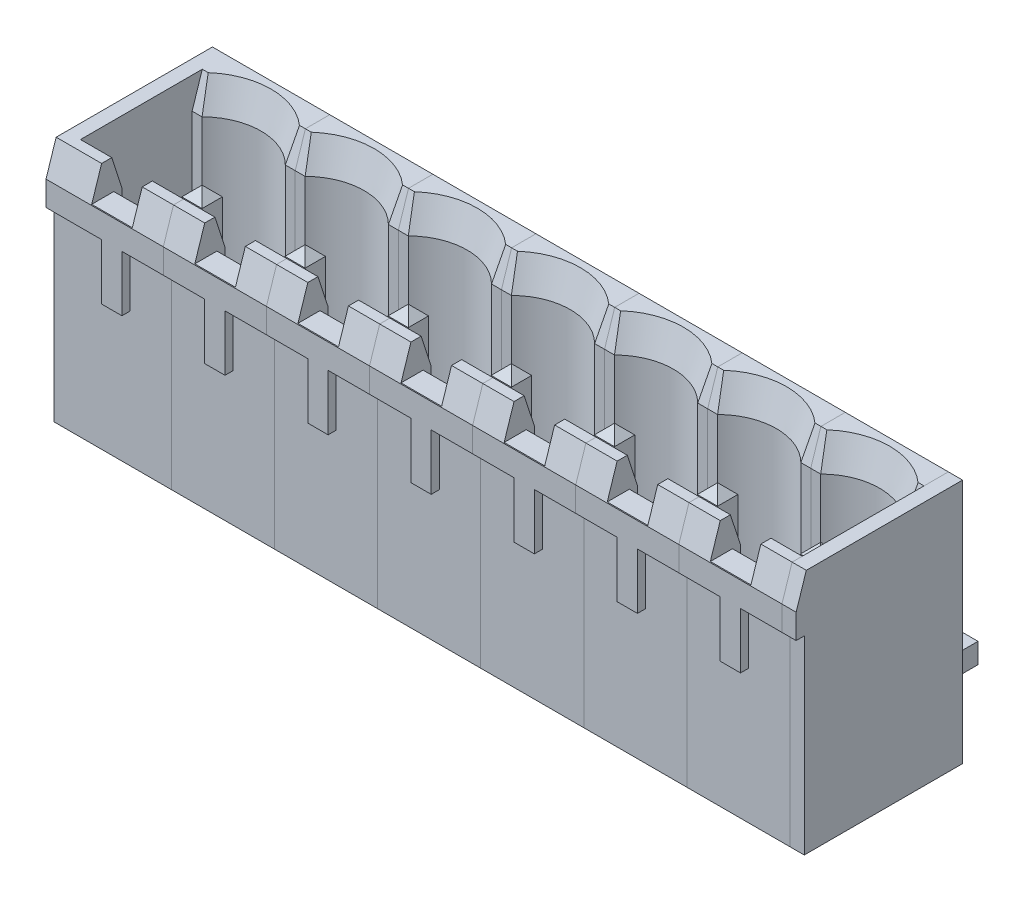
from build123d import *
from OCP.BRepFilletAPI import BRepFilletAPI_MakeChamfer

# Parameters (mm, degrees)
SKETCH_1_W             = 5.08
SKETCH_1_H             = 12.1
EXTRUDE_1_DEPTH        = 8.2
CUT_EXTRUDE_1_DEPTH    = 8.7
SKETCH_3_R             = 1.2
EXTRUDE_2_DEPTH        = 2
FILLET_1_R             = 0.25
CHAMFER_1_SIZE         = 0.5
CHAMFER_1_SIZE2        = 1.538841769
SKETCH_4_W             = 2
SKETCH_4_H             = 1.010953213
CUT_EXTRUDE_2_DEPTH    = 4.75
SKETCH_5_W             = 2
SKETCH_5_H             = 1.705458635
CUT_EXTRUDE_3_DEPTH    = 1.5
CHAMFER_2_SIZE         = 0.5
CHAMFER_2_SIZE2        = 1.538841769
SKETCH_6_W             = 5.08
SKETCH_6_H             = 6.6
CUT_EXTRUDE_4_DEPTH    = 0.4
SKETCH_7_W             = 2.04
SKETCH_7_H             = 2.75
CUT_EXTRUDE_5_DEPTH    = 0.4
EXTRUDE_1_2_DEPTH      = 0.5
EXTRUDE_1_2_DEPTH_BACK = 0.5
CHAMFER_3_SIZE         = 0.5
SKETCH_9_W             = 1
SKETCH_9_H             = 2.1
SKETCH_9_W_2           = 1.04
CUT_EXTRUDE_6_DEPTH    = 6
PATTERN_LINEAR_1_COUNT = 7
PATTERN_LINEAR_1_PITCH = 5.08
EXTRUDE_3_DEPTH        = 0.7
EXTRUDE_4_DEPTH        = 0.7
MOVE_BODY_1_ANGLE      = 180


with BuildPart() as part:
    # Эскиз1 → Extrude 1 (new body)
    with BuildSketch(Plane(origin=(0, 0, 0), x_dir=(1, 0, 0), z_dir=(0, 1, 0))):
        Rectangle(SKETCH_1_W, SKETCH_1_H)
    extrude(amount=EXTRUDE_1_DEPTH)

    # Эскиз2 → Вырез-Вытянуть1 (cut)
    with BuildSketch(Plane.XY.offset(6.05)):
        with BuildLine():
            Line((-2.54, 6.7), (2.54, 6.7))
            Line((2.54, 6.7), (2.54, 1.7))
            Line((2.54, 1.7), (2.05121915, 1.7))
            ThreePointArc((2.05121915, 1.7), (0, 0.85), (-2.05121915, 1.7))
            Line((-2.05121915, 1.7), (-2.54, 1.7))
            Line((-2.54, 1.7), (-2.54, 6.7))
        make_face()
    extrude(amount=-CUT_EXTRUDE_1_DEPTH, mode=Mode.SUBTRACT)

    # Эскиз3 → Бобышка-Вытянуть2 (add)
    with BuildSketch(Plane.XY.offset(-2.65)):
        with Locations((0, 3.75)):
            Circle(SKETCH_3_R)
    extrude(amount=EXTRUDE_2_DEPTH)

    # Скругление1
    fillet_1_edges = [part.edges().sort_by_distance(p)[0] for p in [
        (-1.2, 3.75, -0.65),
    ]]
    fillet(fillet_1_edges, radius=FILLET_1_R)

    # Фаска1: one chamfer whose edges measure the first distance from different faces: ONE call of the kernel's chamfer builder (chamfer() names one face for all edges)
    chamfer_1_edges_1 = [part.edges().sort_by_distance(p)[0] for p in [
        (0, 6.7, 6.05),
    ]]
    chamfer_1_side_1 = [part.faces().sort_by_distance(p)[0] for p in [
        (0, 7.45, 6.05),
    ]]
    chamfer_1_edges_2 = [part.edges().sort_by_distance(p)[0] for p in [
        (2.295609575, 1.7, 6.05),
        (-2.295609575, 1.7, 6.05),
        (0, 0.85, 6.05),
    ]]
    chamfer_1_side_2 = [part.faces().sort_by_distance(p)[0] for p in [
        (0, 0.655214235, 6.05),
    ]]
    chamfer_1 = BRepFilletAPI_MakeChamfer(part.part.solid().wrapped)
    for e in chamfer_1_edges_1:
        chamfer_1.Add(CHAMFER_1_SIZE, CHAMFER_1_SIZE2, e.wrapped, chamfer_1_side_1[0].wrapped)  # the first distance lies on this face
    for e in chamfer_1_edges_2:
        chamfer_1.Add(CHAMFER_1_SIZE, CHAMFER_1_SIZE2, e.wrapped, chamfer_1_side_2[0].wrapped)  # the first distance lies on this face
    add(Compound.cast(chamfer_1.Shape()), mode=Mode.REPLACE)

    # Эскиз4 → Вырез-Вытянуть2 (cut)
    with BuildSketch(Plane.XY.offset(6.05)):
        with Locations((0, 6.594523394)):
            Rectangle(SKETCH_4_W, SKETCH_4_H)
    extrude(amount=-CUT_EXTRUDE_2_DEPTH, mode=Mode.SUBTRACT)

    # Эскиз5 → Вырез-Вытянуть3 (cut)
    with BuildSketch(Plane.XY.offset(6.05)):
        with Locations((0, 7.552729318)):
            Rectangle(SKETCH_5_W, SKETCH_5_H)
    extrude(amount=-CUT_EXTRUDE_3_DEPTH, mode=Mode.SUBTRACT)

    # Фаска2
    chamfer_2_edges = [part.edges().sort_by_distance(p)[0] for p in [
        (-1.77, 8.2, 6.05),
    ]]
    chamfer_2_side = [part.faces().sort_by_distance(p)[0] for p in [
        (-1.77, 7.7, 6.05),
    ]]
    chamfer(chamfer_2_edges, length=CHAMFER_2_SIZE, length2=CHAMFER_2_SIZE2, reference=chamfer_2_side[0])

    # Эскиз6 → Вырез-Вытянуть4 (cut)
    with BuildSketch(Plane(origin=(0, 8.2, 0), x_dir=(1, 0, 0), z_dir=(0, 1, 0))):
        with Locations((0, 2.75)):
            Rectangle(SKETCH_6_W, SKETCH_6_H)
    extrude(amount=-CUT_EXTRUDE_4_DEPTH, mode=Mode.SUBTRACT)

    # Эскиз7 → Вырез-Вытянуть5 (cut)
    with BuildSketch(Plane(origin=(0, 8.2, 0), x_dir=(1, 0, 0), z_dir=(0, 1, 0))):
        with Locations((1.52, -1.925)):
            Rectangle(SKETCH_7_W, SKETCH_7_H)
        with Locations((-1.52, -1.925)):
            Rectangle(SKETCH_7_W, SKETCH_7_H)
    extrude(amount=-CUT_EXTRUDE_5_DEPTH, mode=Mode.SUBTRACT)

    # Эскиз9 → Вырез-Вытянуть6 (cut)
    with BuildSketch(Plane.XZ):
        with Locations((0, -5)):
            Rectangle(SKETCH_9_W, SKETCH_9_H)
        with Locations((-2.02, -5)):
            Rectangle(SKETCH_9_W_2, SKETCH_9_H)
        with Locations((2.02, -5)):
            Rectangle(SKETCH_9_W_2, SKETCH_9_H)
    extrude(amount=-CUT_EXTRUDE_6_DEPTH, mode=Mode.SUBTRACT)


with BuildPart() as body_2:
    # Эскиз8 → Extrude 1 2 (new, two sides: drawn at the far end of the back side and taken through both)
    with BuildSketch(Plane(origin=(0, 0, 0), x_dir=(0, 0, -1), z_dir=(1, 0, 0)).offset(-EXTRUDE_1_2_DEPTH_BACK)):
        with BuildLine():
            Line((-3.65, 3.25), (3.95, 3.25))
            Line((3.95, 3.25), (3.95, -4))
            Line((3.95, -4), (4.95, -4))
            Line((4.95, -4), (4.95, 3.25))
            ThreePointArc((4.95, 3.25), (4.657106781, 3.957106781), (3.95, 4.25))
            Line((3.95, 4.25), (-3.65, 4.25))
            Line((-3.65, 4.25), (-3.65, 3.25))
        make_face()
    extrude(amount=EXTRUDE_1_2_DEPTH + EXTRUDE_1_2_DEPTH_BACK)

    # Фаска3
    chamfer_3_edges = [body_2.edges().sort_by_distance(p)[0] for p in [
        (0, 3.25, 3.65),
        (0, 4.25, 3.65),
        (0, -4, -4.95),
        (0, -4, -3.95),
        (0.5, -4, -4.45),
        (0.5, 3.75, 3.65),
        (-0.5, 3.75, 3.65),
        (-0.5, -4, -4.45),
    ]]
    chamfer(chamfer_3_edges, length=CHAMFER_3_SIZE - 0.0001)  # a hair under: the kernel refuses the full size


with BuildPart() as pattern_linear_1_1:
    # Линейный массив1: pattern copy
    add(part.part.moved(Location(Vector(-1, 0, 0) * (1 * PATTERN_LINEAR_1_PITCH))))


with BuildPart() as pattern_linear_1_2:
    # Линейный массив1: pattern copy
    add(part.part.moved(Location(Vector(-1, 0, 0) * (2 * PATTERN_LINEAR_1_PITCH))))


with BuildPart() as pattern_linear_1_3:
    # Линейный массив1: pattern copy
    add(part.part.moved(Location(Vector(-1, 0, 0) * (3 * PATTERN_LINEAR_1_PITCH))))


with BuildPart() as pattern_linear_1_4:
    # Линейный массив1: pattern copy
    add(part.part.moved(Location(Vector(-1, 0, 0) * (4 * PATTERN_LINEAR_1_PITCH))))


with BuildPart() as pattern_linear_1_5:
    # Линейный массив1: pattern copy
    add(part.part.moved(Location(Vector(-1, 0, 0) * (5 * PATTERN_LINEAR_1_PITCH))))


with BuildPart() as pattern_linear_1_6:
    # Линейный массив1: pattern copy
    add(part.part.moved(Location(Vector(-1, 0, 0) * (6 * PATTERN_LINEAR_1_PITCH))))


with BuildPart() as pattern_linear_1_7:
    # Линейный массив1: pattern copy
    add(body_2.part.moved(Location(Vector(-1, 0, 0) * (1 * PATTERN_LINEAR_1_PITCH))))


with BuildPart() as pattern_linear_1_8:
    # Линейный массив1: pattern copy
    add(body_2.part.moved(Location(Vector(-1, 0, 0) * (2 * PATTERN_LINEAR_1_PITCH))))


with BuildPart() as pattern_linear_1_9:
    # Линейный массив1: pattern copy
    add(body_2.part.moved(Location(Vector(-1, 0, 0) * (3 * PATTERN_LINEAR_1_PITCH))))


with BuildPart() as pattern_linear_1_10:
    # Линейный массив1: pattern copy
    add(body_2.part.moved(Location(Vector(-1, 0, 0) * (4 * PATTERN_LINEAR_1_PITCH))))


with BuildPart() as pattern_linear_1_11:
    # Линейный массив1: pattern copy
    add(body_2.part.moved(Location(Vector(-1, 0, 0) * (5 * PATTERN_LINEAR_1_PITCH))))


with BuildPart() as pattern_linear_1_12:
    # Линейный массив1: pattern copy
    add(body_2.part.moved(Location(Vector(-1, 0, 0) * (6 * PATTERN_LINEAR_1_PITCH))))


with BuildPart() as part_1:
    add(part.part)

    # Эскиз10 → Бобышка-Вытянуть3 (add)
    with BuildSketch(Plane(origin=(2.54, 0, 0), x_dir=(0, 0, -1), z_dir=(1, 0, 0))):
        Polygon((6.05, 7.8), (-3.3, 7.8), (-3.3, 8.2), (-4.511158231, 8.2), (-6.05, 7.7), (-6.05, 0), (6.05, 0), align=None)
    extrude(amount=EXTRUDE_3_DEPTH)


with BuildPart() as body_15:
    # Эскиз11 → Бобышка-Вытянуть4 (new body)
    with BuildSketch(Plane.ZY.offset(33.02)):
        Polygon((-6.05, 7.8), (-6.05, 0), (6.05, 0), (6.05, 7.7), (4.511158231, 8.2), (3.3, 8.2), (3.3, 7.8), align=None)
    extrude(amount=EXTRUDE_4_DEPTH)


with BuildPart() as body_2_1:
    # Move Body 1: moved
    add(body_2.part.rotate(Axis((0, 0, 0), (0, 0.7071067811865488, 0.7071067811865462)), MOVE_BODY_1_ANGLE))


with BuildPart() as pattern_linear_1_7_1:
    # Move Body 1: moved
    add(pattern_linear_1_7.part.rotate(Axis((0, 0, 0), (0, 0.7071067811865488, 0.7071067811865462)), MOVE_BODY_1_ANGLE))


with BuildPart() as pattern_linear_1_1_1:
    # Move Body 1: moved
    add(pattern_linear_1_1.part.rotate(Axis((0, 0, 0), (0, 0.7071067811865488, 0.7071067811865462)), MOVE_BODY_1_ANGLE))


with BuildPart() as pattern_linear_1_2_1:
    # Move Body 1: moved
    add(pattern_linear_1_2.part.rotate(Axis((0, 0, 0), (0, 0.7071067811865488, 0.7071067811865462)), MOVE_BODY_1_ANGLE))


with BuildPart() as pattern_linear_1_3_1:
    # Move Body 1: moved
    add(pattern_linear_1_3.part.rotate(Axis((0, 0, 0), (0, 0.7071067811865488, 0.7071067811865462)), MOVE_BODY_1_ANGLE))


with BuildPart() as pattern_linear_1_8_1:
    # Move Body 1: moved
    add(pattern_linear_1_8.part.rotate(Axis((0, 0, 0), (0, 0.7071067811865488, 0.7071067811865462)), MOVE_BODY_1_ANGLE))


with BuildPart() as pattern_linear_1_9_1:
    # Move Body 1: moved
    add(pattern_linear_1_9.part.rotate(Axis((0, 0, 0), (0, 0.7071067811865488, 0.7071067811865462)), MOVE_BODY_1_ANGLE))


with BuildPart() as pattern_linear_1_10_1:
    # Move Body 1: moved
    add(pattern_linear_1_10.part.rotate(Axis((0, 0, 0), (0, 0.7071067811865488, 0.7071067811865462)), MOVE_BODY_1_ANGLE))


with BuildPart() as pattern_linear_1_11_1:
    # Move Body 1: moved
    add(pattern_linear_1_11.part.rotate(Axis((0, 0, 0), (0, 0.7071067811865488, 0.7071067811865462)), MOVE_BODY_1_ANGLE))


with BuildPart() as pattern_linear_1_12_1:
    # Move Body 1: moved
    add(pattern_linear_1_12.part.rotate(Axis((0, 0, 0), (0, 0.7071067811865488, 0.7071067811865462)), MOVE_BODY_1_ANGLE))


with BuildPart() as pattern_linear_1_4_1:
    # Move Body 1: moved
    add(pattern_linear_1_4.part.rotate(Axis((0, 0, 0), (0, 0.7071067811865488, 0.7071067811865462)), MOVE_BODY_1_ANGLE))


with BuildPart() as pattern_linear_1_5_1:
    # Move Body 1: moved
    add(pattern_linear_1_5.part.rotate(Axis((0, 0, 0), (0, 0.7071067811865488, 0.7071067811865462)), MOVE_BODY_1_ANGLE))


with BuildPart() as pattern_linear_1_6_1:
    # Move Body 1: moved
    add(pattern_linear_1_6.part.rotate(Axis((0, 0, 0), (0, 0.7071067811865488, 0.7071067811865462)), MOVE_BODY_1_ANGLE))


with BuildPart() as part_2:
    # Move Body 1: moved
    add(part_1.part.rotate(Axis((0, 0, 0), (0, 0.7071067811865488, 0.7071067811865462)), MOVE_BODY_1_ANGLE))


with BuildPart() as body_15_1:
    # Move Body 1: moved
    add(body_15.part.rotate(Axis((0, 0, 0), (0, 0.7071067811865488, 0.7071067811865462)), MOVE_BODY_1_ANGLE))


with BuildPart() as body_15_2:
    # Move Body 2: read off the stored shape, not the designer's step
    # Move Body 2: moved
    add(body_15_1.part.moved(Location((0, 4.45, 0))))


with BuildPart() as part_3:
    # Move Body 2 2: moved
    add(part_2.part.moved(Location((0, 4.45, 0))))


with BuildPart() as pattern_linear_1_6_2:
    # Move Body 2 3: moved
    add(pattern_linear_1_6_1.part.moved(Location((0, 4.45, 0))))


with BuildPart() as pattern_linear_1_5_2:
    # Move Body 2 4: moved
    add(pattern_linear_1_5_1.part.moved(Location((0, 4.45, 0))))


with BuildPart() as pattern_linear_1_4_2:
    # Move Body 2 5: moved
    add(pattern_linear_1_4_1.part.moved(Location((0, 4.45, 0))))


with BuildPart() as pattern_linear_1_12_2:
    # Move Body 2 6: moved
    add(pattern_linear_1_12_1.part.moved(Location((0, 4.45, 0))))


with BuildPart() as pattern_linear_1_11_2:
    # Move Body 2 7: moved
    add(pattern_linear_1_11_1.part.moved(Location((0, 4.45, 0))))


with BuildPart() as pattern_linear_1_10_2:
    # Move Body 2 8: moved
    add(pattern_linear_1_10_1.part.moved(Location((0, 4.45, 0))))


with BuildPart() as pattern_linear_1_9_2:
    # Move Body 2 9: moved
    add(pattern_linear_1_9_1.part.moved(Location((0, 4.45, 0))))


with BuildPart() as pattern_linear_1_8_2:
    # Move Body 2 10: moved
    add(pattern_linear_1_8_1.part.moved(Location((0, 4.45, 0))))


with BuildPart() as pattern_linear_1_3_2:
    # Move Body 2 11: moved
    add(pattern_linear_1_3_1.part.moved(Location((0, 4.45, 0))))


with BuildPart() as pattern_linear_1_2_2:
    # Move Body 2 12: moved
    add(pattern_linear_1_2_1.part.moved(Location((0, 4.45, 0))))


with BuildPart() as pattern_linear_1_1_2:
    # Move Body 2 13: moved
    add(pattern_linear_1_1_1.part.moved(Location((0, 4.45, 0))))


with BuildPart() as pattern_linear_1_7_2:
    # Move Body 2 14: moved
    add(pattern_linear_1_7_1.part.moved(Location((0, 4.45, 0))))


with BuildPart() as body_2_2:
    # Move Body 2 15: moved
    add(body_2_1.part.moved(Location((0, 4.45, 0))))


solid = Compound([body_15_2.part, part_3.part, pattern_linear_1_6_2.part, pattern_linear_1_5_2.part, pattern_linear_1_4_2.part, pattern_linear_1_12_2.part, pattern_linear_1_11_2.part, pattern_linear_1_10_2.part, pattern_linear_1_9_2.part, pattern_linear_1_8_2.part, pattern_linear_1_3_2.part, pattern_linear_1_2_2.part, pattern_linear_1_1_2.part, pattern_linear_1_7_2.part, body_2_2.part])
